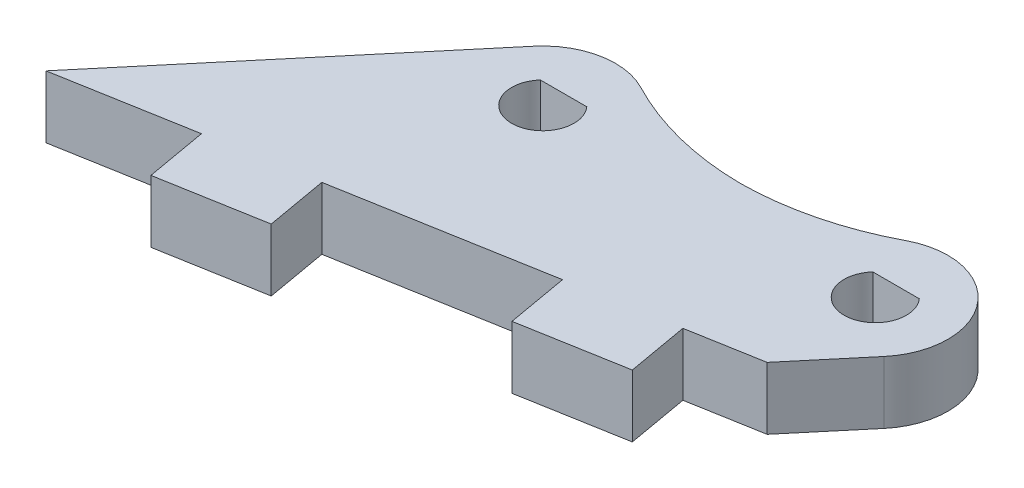
from build123d import *

# Parameters (mm, degrees)
SKETCH_2_R      = 3.5
SKETCH_2_R_2    = 1.5
EXTRUDE_1_DEPTH = 3
FILLET_1_R      = 14
SKETCH_3_W      = 5
SKETCH_3_H      = 3
EXTRUDE_2_DEPTH = 3
EXTRUDE_4_DEPTH = 3


with BuildPart() as part:
    # 草图2 → 凸台-拉伸1 (new body)
    # profile 1 of 3: a face of its own
    with BuildSketch(Plane(origin=(0, 0, 0), x_dir=(1, 0, 0), z_dir=(0, 1, 0))):
        with Locations((-16, 0)):
            Circle(SKETCH_2_R)
        with Locations(Location((-16, 0, 0), (0, 0, 270))):
            Circle(SKETCH_2_R_2, mode=Mode.SUBTRACT)
    # profile 2 of 3: a face of its own
    with BuildSketch(Plane(origin=(0, 0, 0), x_dir=(1, 0, 0), z_dir=(0, 1, 0))):
        Circle(SKETCH_2_R)
        with Locations(Location((0, 0, 0), (0, 0, 270))):
            Circle(SKETCH_2_R_2, mode=Mode.SUBTRACT)
    # profile 3 of 3: a face of its own
    with BuildSketch(Plane(origin=(0, 0, 0), x_dir=(1, 0, 0), z_dir=(0, 1, 0))):
        with BuildLine():
            Line((-3.16227766, 1.5), (-12.83772234, 1.5))
            ThreePointArc((-12.83772234, 1.5), (-12.585474278, 0.768774411), (-12.5, 0))
            ThreePointArc((-12.5, 0), (-17.197070502, -3.288924173), (-18.681155551, 2.249756634))
            Line((-18.681155551, 2.249756634), (-29.392987934, -10.516108092))
            Line((-29.392987934, -10.516108092), (0.110005112, -5.313934406))
            Line((0.110005112, -5.313934406), (2.681155551, -2.249756634))
            ThreePointArc((2.681155551, -2.249756634), (-1.890248218, -2.94566829), (-3.16227766, 1.5))
        make_face()
    extrude(amount=EXTRUDE_1_DEPTH)

    # 圆角1
    # the kernel refuses this fillet: 14 mm, written as the material it adds along each edge
    with BuildSketch(Plane(origin=(-3.16227766, 0, -1.5), x_dir=(-1, 0, 0), z_dir=(0, 1, 0))) as fillet_1_piece_1:
        with BuildLine():
            CenterArc((4.961760744, -14), FILLET_1_R, 90, 27.660449899)
            ThreePointArc((-1.537469979, -1.6), (-0.638580667, -0.925067728), (0, 0))
            Line((0, 0), (4.961760744, 0))
        make_face()
    extrude(amount=3)
    with BuildSketch(Plane(origin=(-12.83772234, 0, -1.5), x_dir=(-0.6928764936482941, 0, -0.721056283898591), z_dir=(0, 1, 0))) as fillet_1_piece_2:
        with BuildLine():
            CenterArc((6.656900588, -13.277979675), FILLET_1_R, 108.481308288, 27.660449899)
            Line((-3.437887387, -3.577708764), (0, 0))
            ThreePointArc((0, 0), (1.109483431, -0.180505081), (2.218966863, 0))
        make_face()
    extrude(amount=3)

    # 草图3 → 凸台-拉伸2 (add)
    with BuildSketch(Plane(origin=(0.912053364, 0, 5.17251166), x_dir=(0.9848077530122087, 0, -0.17364817766692722), z_dir=(0.17364817766692722, 0, 0.9848077530122087))):
        with Locations((-21.814421139, 1.5)):
            Rectangle(SKETCH_3_W, SKETCH_3_H)
        with Locations((-6.814421139, 1.5)):
            Rectangle(SKETCH_3_W, SKETCH_3_H)
    extrude(amount=EXTRUDE_2_DEPTH)

    # 草图5 → 凸台-拉伸4 (add)
    with BuildSketch(Plane.XZ):
        with BuildLine():
            ThreePointArc((-1.118033989, -1), (0, -1.5), (1.118033989, -1))
            Line((1.118033989, -1), (-1.118033989, -1))
        make_face()
        with BuildLine():
            ThreePointArc((-17.118033989, -1), (-16, -1.5), (-14.881966011, -1))
            Line((-14.881966011, -1), (-17.118033989, -1))
        make_face()
    extrude(amount=-EXTRUDE_4_DEPTH)


solid = part.part
